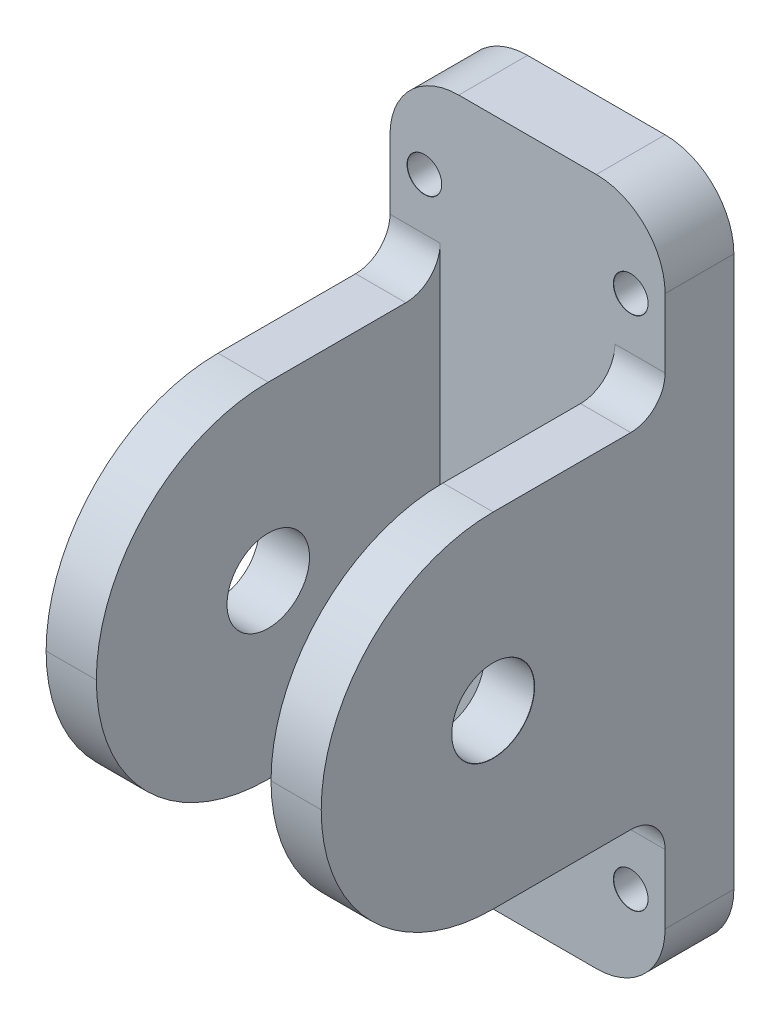
from build123d import *

# Parameters (mm, degrees)
SKETCH1_W                        = 100
SKETCH1_H                        = 40
BOSS_EXTRUDE1_DEPTH              = 10
SKETCH2_W                        = 50
SKETCH2_H                        = 7.3
BOSS_EXTRUDE2_DEPTH              = 50
FILLET1_R                        = 25
F_12_0MM_DOWEL_HOLE1_D           = 12
F_12_0MM_DOWEL_HOLE1_CSINK_D     = 12.05
F_12_0MM_DOWEL_HOLE1_CSINK_ANGLE = 90
F_5_0MM_DOWEL_HOLE1_D            = 5
F_5_0MM_DOWEL_HOLE1_CSINK_D      = 5.05
F_5_0MM_DOWEL_HOLE1_CSINK_ANGLE  = 90
FILLET2_R                        = 10
FILLET3_R                        = 5


with BuildPart() as part:
    # Sketch1 → Boss-Extrude1 (new body)
    with BuildSketch(Plane(origin=(0, 0, 0), x_dir=(0, 1, 0), z_dir=(0, 0, 1))):
        Rectangle(SKETCH1_W, SKETCH1_H)
    extrude(amount=-BOSS_EXTRUDE1_DEPTH)

    # Sketch2 → Boss-Extrude2 (add)
    with BuildSketch(Plane(origin=(0, 0, 0), x_dir=(0, 1, 0), z_dir=(0, 0, 1))):
        with Locations((0, 16.35)):
            Rectangle(SKETCH2_W, SKETCH2_H)
        with Locations((0, -16.35)):
            Rectangle(SKETCH2_W, SKETCH2_H)
    extrude(amount=BOSS_EXTRUDE2_DEPTH)

    # Fillet1
    fillet1_edges = [part.edges().sort_by_distance(p)[0] for p in [
        (16.35, 25, 50),
        (16.35, -25, 50),
        (-16.35, 25, 50),
        (-16.35, -25, 50),
    ]]
    fillet(fillet1_edges, radius=FILLET1_R - 0.0001)  # a hair under: the kernel refuses the full size

    # Ø12.0mm Dowel Hole1 (through all)
    with Locations(Plane.YZ.offset(20)):
        with Locations((0, 25)):
            CounterSinkHole(F_12_0MM_DOWEL_HOLE1_D / 2, F_12_0MM_DOWEL_HOLE1_CSINK_D / 2, counter_sink_angle=F_12_0MM_DOWEL_HOLE1_CSINK_ANGLE)

    # Ø5.0mm Dowel Hole1 (through all)
    with Locations(Plane(origin=(0, 0, 0), x_dir=(0, 1, 0), z_dir=(0, 0, 1))):
        with Locations((37.5, -15), (-37.5, 15), (-37.5, -15), (37.5, 15)):
            CounterSinkHole(F_5_0MM_DOWEL_HOLE1_D / 2, F_5_0MM_DOWEL_HOLE1_CSINK_D / 2, counter_sink_angle=F_5_0MM_DOWEL_HOLE1_CSINK_ANGLE)

    # Fillet2
    fillet2_edges = [part.edges().sort_by_distance(p)[0] for p in [
        (-20, -50, -5),
        (-20, 50, -5),
        (20, 50, -5),
        (20, -50, -5),
    ]]
    fillet(fillet2_edges, radius=FILLET2_R)

    # Fillet3
    fillet3_edges = [part.edges().sort_by_distance(p)[0] for p in [
        (-16.35, -25, 0),
        (-16.35, 25, 0),
        (16.35, -25, 0),
        (16.35, 25, 0),
    ]]
    fillet(fillet3_edges, radius=FILLET3_R)


solid = part.part
